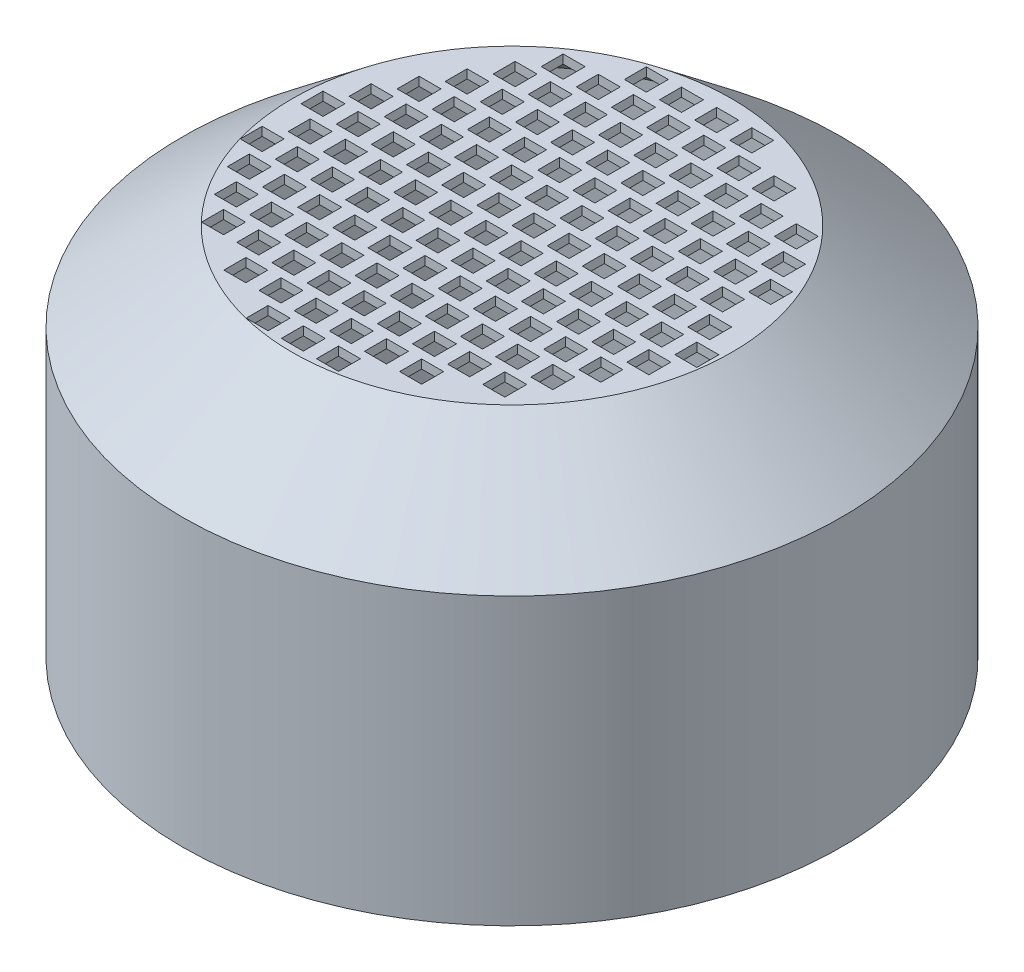
from build123d import *

# Parameters (mm, degrees)
SKETCH1_R               = 75
BOSS_EXTRUDE1_DEPTH     = 85
CHAMFER1_SIZE           = 20
CHAMFER1_SIZE2          = 25
SHELL1_T                = -2
SKETCH2_W               = 5
SKETCH2_H               = 5
CUT_EXTRUDE1_DEPTH      = 136.922772191
FILL_START              = 82.470761888
FILL_PATTERN1_OUTLINE_W = 5
FILL_PATTERN1_OUTLINE_H = 5
FILL_PATTERN1_DEPTH     = 2.529238112
EXTRUDE_THIN1_REACH     = 137.923
SKETCH3_R               = 66.5
SKETCH3_R_2             = 65


# Read off the part's stored shape, not the designer's step: Fill Pattern1
with BuildPart() as part:
    # Sketch1 → Boss-Extrude1 (new body)
    with BuildSketch(Plane(origin=(0, 0, 0), x_dir=(1, 0, 0), z_dir=(0, 1, 0))):
        with Locations(Location((0, 0, 0), (0, 0, 270))):
            Circle(SKETCH1_R)
    extrude(amount=BOSS_EXTRUDE1_DEPTH)

    # Chamfer1
    chamfer1_edges = [part.edges().sort_by_distance(p)[0] for p in [
        (0, 85, -75),
    ]]
    chamfer1_side = [part.faces().sort_by_distance(p)[0] for p in [
        (0, 42.5, -75),
    ]]
    chamfer(chamfer1_edges, length=CHAMFER1_SIZE, length2=CHAMFER1_SIZE2, reference=chamfer1_side[0])

    # Shell1
    shell1_openings = [part.faces().sort_by_distance(p)[0] for p in [
        (0, 0, 0),
    ]]
    offset(amount=SHELL1_T, openings=shell1_openings, kind=Kind.INTERSECTION)

    # Sketch2 → Cut-Extrude1 (cut, through all)
    with BuildSketch(Plane(origin=(0, 85, 0), x_dir=(1, 0, 0), z_dir=(0, 1, 0))):
        with Locations((2.5, 2.5)):
            Rectangle(SKETCH2_W, SKETCH2_H)
    extrude(amount=-CUT_EXTRUDE1_DEPTH, mode=Mode.SUBTRACT)

    # Fill Pattern1 outline → Fill Pattern1 (cut)
    with BuildSketch(Plane(origin=(0, 0, 0), x_dir=(1, 0, 0), z_dir=(0, 1, 0)).offset(FILL_START)):
        with Locations((2.5, 30.212812921)):
            Rectangle(FILL_PATTERN1_OUTLINE_W, FILL_PATTERN1_OUTLINE_H)
        with Locations((2.5, 44.069219382)):
            Rectangle(FILL_PATTERN1_OUTLINE_W, FILL_PATTERN1_OUTLINE_H)
        with Locations((2.5, 16.356406461)):
            Rectangle(FILL_PATTERN1_OUTLINE_W, FILL_PATTERN1_OUTLINE_H)
        with Locations((2.5, -39.069219382)):
            Rectangle(FILL_PATTERN1_OUTLINE_W, FILL_PATTERN1_OUTLINE_H)
        with Locations((2.5, -11.356406461)):
            Rectangle(FILL_PATTERN1_OUTLINE_W, FILL_PATTERN1_OUTLINE_H)
        with Locations((2.5, -25.212812921)):
            Rectangle(FILL_PATTERN1_OUTLINE_W, FILL_PATTERN1_OUTLINE_H)
        with Locations((-45.5, 2.5)):
            Rectangle(FILL_PATTERN1_OUTLINE_W, FILL_PATTERN1_OUTLINE_H)
        with Locations((-13.5, 2.5)):
            Rectangle(FILL_PATTERN1_OUTLINE_W, FILL_PATTERN1_OUTLINE_H)
        with Locations((-5.5, 2.5)):
            Rectangle(FILL_PATTERN1_OUTLINE_W, FILL_PATTERN1_OUTLINE_H)
        with Locations((-37.5, 2.5)):
            Rectangle(FILL_PATTERN1_OUTLINE_W, FILL_PATTERN1_OUTLINE_H)
        with Locations((-21.5, 2.5)):
            Rectangle(FILL_PATTERN1_OUTLINE_W, FILL_PATTERN1_OUTLINE_H)
        with Locations((-29.5, 2.5)):
            Rectangle(FILL_PATTERN1_OUTLINE_W, FILL_PATTERN1_OUTLINE_H)
        with Locations((26.5, 2.5)):
            Rectangle(FILL_PATTERN1_OUTLINE_W, FILL_PATTERN1_OUTLINE_H)
        with Locations((42.5, 2.5)):
            Rectangle(FILL_PATTERN1_OUTLINE_W, FILL_PATTERN1_OUTLINE_H)
        with Locations((34.5, 2.5)):
            Rectangle(FILL_PATTERN1_OUTLINE_W, FILL_PATTERN1_OUTLINE_H)
        with Locations((10.5, 2.5)):
            Rectangle(FILL_PATTERN1_OUTLINE_W, FILL_PATTERN1_OUTLINE_H)
        with Locations((18.5, 2.5)):
            Rectangle(FILL_PATTERN1_OUTLINE_W, FILL_PATTERN1_OUTLINE_H)
        with Locations((-45.5, -11.356406461)):
            Rectangle(FILL_PATTERN1_OUTLINE_W, FILL_PATTERN1_OUTLINE_H)
        with Locations((-33.5, -32.141016151)):
            Rectangle(FILL_PATTERN1_OUTLINE_W, FILL_PATTERN1_OUTLINE_H)
        with Locations((-17.5, -32.141016151)):
            Rectangle(FILL_PATTERN1_OUTLINE_W, FILL_PATTERN1_OUTLINE_H)
        with Locations((-25.5, -32.141016151)):
            Rectangle(FILL_PATTERN1_OUTLINE_W, FILL_PATTERN1_OUTLINE_H)
        with Locations((14.5, -32.141016151)):
            Rectangle(FILL_PATTERN1_OUTLINE_W, FILL_PATTERN1_OUTLINE_H)
        with Locations((6.5, -32.141016151)):
            Rectangle(FILL_PATTERN1_OUTLINE_W, FILL_PATTERN1_OUTLINE_H)
        with Locations((30.5, -32.141016151)):
            Rectangle(FILL_PATTERN1_OUTLINE_W, FILL_PATTERN1_OUTLINE_H)
        with Locations((22.5, -32.141016151)):
            Rectangle(FILL_PATTERN1_OUTLINE_W, FILL_PATTERN1_OUTLINE_H)
        with Locations((-9.5, -32.141016151)):
            Rectangle(FILL_PATTERN1_OUTLINE_W, FILL_PATTERN1_OUTLINE_H)
        with Locations((-1.5, -32.141016151)):
            Rectangle(FILL_PATTERN1_OUTLINE_W, FILL_PATTERN1_OUTLINE_H)
        with Locations((-33.5, 9.42820323)):
            Rectangle(FILL_PATTERN1_OUTLINE_W, FILL_PATTERN1_OUTLINE_H)
        with Locations((-33.5, 23.284609691)):
            Rectangle(FILL_PATTERN1_OUTLINE_W, FILL_PATTERN1_OUTLINE_H)
        with Locations((-33.5, -18.284609691)):
            Rectangle(FILL_PATTERN1_OUTLINE_W, FILL_PATTERN1_OUTLINE_H)
        with Locations((-33.5, -4.42820323)):
            Rectangle(FILL_PATTERN1_OUTLINE_W, FILL_PATTERN1_OUTLINE_H)
        with Locations((-21.5, -11.356406461)):
            Rectangle(FILL_PATTERN1_OUTLINE_W, FILL_PATTERN1_OUTLINE_H)
        with Locations((-13.5, -11.356406461)):
            Rectangle(FILL_PATTERN1_OUTLINE_W, FILL_PATTERN1_OUTLINE_H)
        with Locations((-29.5, -11.356406461)):
            Rectangle(FILL_PATTERN1_OUTLINE_W, FILL_PATTERN1_OUTLINE_H)
        with Locations((-37.5, -11.356406461)):
            Rectangle(FILL_PATTERN1_OUTLINE_W, FILL_PATTERN1_OUTLINE_H)
        with Locations((26.5, -11.356406461)):
            Rectangle(FILL_PATTERN1_OUTLINE_W, FILL_PATTERN1_OUTLINE_H)
        with Locations((18.5, -11.356406461)):
            Rectangle(FILL_PATTERN1_OUTLINE_W, FILL_PATTERN1_OUTLINE_H)
        with Locations((34.5, -11.356406461)):
            Rectangle(FILL_PATTERN1_OUTLINE_W, FILL_PATTERN1_OUTLINE_H)
        with Locations((42.5, -11.356406461)):
            Rectangle(FILL_PATTERN1_OUTLINE_W, FILL_PATTERN1_OUTLINE_H)
        with Locations((-5.5, -11.356406461)):
            Rectangle(FILL_PATTERN1_OUTLINE_W, FILL_PATTERN1_OUTLINE_H)
        with Locations((10.5, -11.356406461)):
            Rectangle(FILL_PATTERN1_OUTLINE_W, FILL_PATTERN1_OUTLINE_H)
        with Locations((6.5, -45.997422612)):
            Rectangle(FILL_PATTERN1_OUTLINE_W, FILL_PATTERN1_OUTLINE_H)
        with Locations((6.5, 37.141016151)):
            Rectangle(FILL_PATTERN1_OUTLINE_W, FILL_PATTERN1_OUTLINE_H)
        with Locations((6.5, 23.284609691)):
            Rectangle(FILL_PATTERN1_OUTLINE_W, FILL_PATTERN1_OUTLINE_H)
        with Locations((6.5, -4.42820323)):
            Rectangle(FILL_PATTERN1_OUTLINE_W, FILL_PATTERN1_OUTLINE_H)
        with Locations((6.5, 9.42820323)):
            Rectangle(FILL_PATTERN1_OUTLINE_W, FILL_PATTERN1_OUTLINE_H)
        with Locations((6.5, -18.284609691)):
            Rectangle(FILL_PATTERN1_OUTLINE_W, FILL_PATTERN1_OUTLINE_H)
        with Locations((-9.5, -45.997422612)):
            Rectangle(FILL_PATTERN1_OUTLINE_W, FILL_PATTERN1_OUTLINE_H)
        with Locations((-1.5, -45.997422612)):
            Rectangle(FILL_PATTERN1_OUTLINE_W, FILL_PATTERN1_OUTLINE_H)
        with Locations((46.5, -4.42820323)):
            Rectangle(FILL_PATTERN1_OUTLINE_W, FILL_PATTERN1_OUTLINE_H)
        with Locations((-17.5, -4.42820323)):
            Rectangle(FILL_PATTERN1_OUTLINE_W, FILL_PATTERN1_OUTLINE_H)
        with Locations((-9.5, -4.42820323)):
            Rectangle(FILL_PATTERN1_OUTLINE_W, FILL_PATTERN1_OUTLINE_H)
        with Locations((-41.5, -4.42820323)):
            Rectangle(FILL_PATTERN1_OUTLINE_W, FILL_PATTERN1_OUTLINE_H)
        with Locations((-25.5, -4.42820323)):
            Rectangle(FILL_PATTERN1_OUTLINE_W, FILL_PATTERN1_OUTLINE_H)
        with Locations((22.5, -4.42820323)):
            Rectangle(FILL_PATTERN1_OUTLINE_W, FILL_PATTERN1_OUTLINE_H)
        with Locations((38.5, -4.42820323)):
            Rectangle(FILL_PATTERN1_OUTLINE_W, FILL_PATTERN1_OUTLINE_H)
        with Locations((30.5, -4.42820323)):
            Rectangle(FILL_PATTERN1_OUTLINE_W, FILL_PATTERN1_OUTLINE_H)
        with Locations((-1.5, -4.42820323)):
            Rectangle(FILL_PATTERN1_OUTLINE_W, FILL_PATTERN1_OUTLINE_H)
        with Locations((14.5, -4.42820323)):
            Rectangle(FILL_PATTERN1_OUTLINE_W, FILL_PATTERN1_OUTLINE_H)
        with Locations((34.5, 30.212812921)):
            Rectangle(FILL_PATTERN1_OUTLINE_W, FILL_PATTERN1_OUTLINE_H)
        with Locations((34.5, 16.356406461)):
            Rectangle(FILL_PATTERN1_OUTLINE_W, FILL_PATTERN1_OUTLINE_H)
        with Locations((34.5, -25.212812921)):
            Rectangle(FILL_PATTERN1_OUTLINE_W, FILL_PATTERN1_OUTLINE_H)
        with Locations((-5.5, 30.212812921)):
            Rectangle(FILL_PATTERN1_OUTLINE_W, FILL_PATTERN1_OUTLINE_H)
        with Locations((10.5, 30.212812921)):
            Rectangle(FILL_PATTERN1_OUTLINE_W, FILL_PATTERN1_OUTLINE_H)
        with Locations((-21.5, 30.212812921)):
            Rectangle(FILL_PATTERN1_OUTLINE_W, FILL_PATTERN1_OUTLINE_H)
        with Locations((-29.5, 30.212812921)):
            Rectangle(FILL_PATTERN1_OUTLINE_W, FILL_PATTERN1_OUTLINE_H)
        with Locations((-13.5, 30.212812921)):
            Rectangle(FILL_PATTERN1_OUTLINE_W, FILL_PATTERN1_OUTLINE_H)
        with Locations((18.5, 30.212812921)):
            Rectangle(FILL_PATTERN1_OUTLINE_W, FILL_PATTERN1_OUTLINE_H)
        with Locations((26.5, 30.212812921)):
            Rectangle(FILL_PATTERN1_OUTLINE_W, FILL_PATTERN1_OUTLINE_H)
        with Locations((-9.5, 9.42820323)):
            Rectangle(FILL_PATTERN1_OUTLINE_W, FILL_PATTERN1_OUTLINE_H)
        with Locations((-9.5, 23.284609691)):
            Rectangle(FILL_PATTERN1_OUTLINE_W, FILL_PATTERN1_OUTLINE_H)
        with Locations((-9.5, -18.284609691)):
            Rectangle(FILL_PATTERN1_OUTLINE_W, FILL_PATTERN1_OUTLINE_H)
        with Locations((-9.5, 37.141016151)):
            Rectangle(FILL_PATTERN1_OUTLINE_W, FILL_PATTERN1_OUTLINE_H)
        with Locations((-1.5, 37.141016151)):
            Rectangle(FILL_PATTERN1_OUTLINE_W, FILL_PATTERN1_OUTLINE_H)
        with Locations((14.5, 37.141016151)):
            Rectangle(FILL_PATTERN1_OUTLINE_W, FILL_PATTERN1_OUTLINE_H)
        with Locations((-17.5, 37.141016151)):
            Rectangle(FILL_PATTERN1_OUTLINE_W, FILL_PATTERN1_OUTLINE_H)
        with Locations((-25.5, 37.141016151)):
            Rectangle(FILL_PATTERN1_OUTLINE_W, FILL_PATTERN1_OUTLINE_H)
        with Locations((22.5, 37.141016151)):
            Rectangle(FILL_PATTERN1_OUTLINE_W, FILL_PATTERN1_OUTLINE_H)
        with Locations((-1.5, 23.284609691)):
            Rectangle(FILL_PATTERN1_OUTLINE_W, FILL_PATTERN1_OUTLINE_H)
        with Locations((-1.5, 9.42820323)):
            Rectangle(FILL_PATTERN1_OUTLINE_W, FILL_PATTERN1_OUTLINE_H)
        with Locations((-1.5, -18.284609691)):
            Rectangle(FILL_PATTERN1_OUTLINE_W, FILL_PATTERN1_OUTLINE_H)
        with Locations((-25.5, 23.284609691)):
            Rectangle(FILL_PATTERN1_OUTLINE_W, FILL_PATTERN1_OUTLINE_H)
        with Locations((-17.5, 23.284609691)):
            Rectangle(FILL_PATTERN1_OUTLINE_W, FILL_PATTERN1_OUTLINE_H)
        with Locations((38.5, 23.284609691)):
            Rectangle(FILL_PATTERN1_OUTLINE_W, FILL_PATTERN1_OUTLINE_H)
        with Locations((14.5, 23.284609691)):
            Rectangle(FILL_PATTERN1_OUTLINE_W, FILL_PATTERN1_OUTLINE_H)
        with Locations((30.5, 23.284609691)):
            Rectangle(FILL_PATTERN1_OUTLINE_W, FILL_PATTERN1_OUTLINE_H)
        with Locations((22.5, 23.284609691)):
            Rectangle(FILL_PATTERN1_OUTLINE_W, FILL_PATTERN1_OUTLINE_H)
        with Locations((-5.5, 16.356406461)):
            Rectangle(FILL_PATTERN1_OUTLINE_W, FILL_PATTERN1_OUTLINE_H)
        with Locations((-5.5, 44.069219382)):
            Rectangle(FILL_PATTERN1_OUTLINE_W, FILL_PATTERN1_OUTLINE_H)
        with Locations((-5.5, -25.212812921)):
            Rectangle(FILL_PATTERN1_OUTLINE_W, FILL_PATTERN1_OUTLINE_H)
        with Locations((-5.5, -39.069219382)):
            Rectangle(FILL_PATTERN1_OUTLINE_W, FILL_PATTERN1_OUTLINE_H)
        with Locations((-29.5, 16.356406461)):
            Rectangle(FILL_PATTERN1_OUTLINE_W, FILL_PATTERN1_OUTLINE_H)
        with Locations((-37.5, 16.356406461)):
            Rectangle(FILL_PATTERN1_OUTLINE_W, FILL_PATTERN1_OUTLINE_H)
        with Locations((-13.5, 16.356406461)):
            Rectangle(FILL_PATTERN1_OUTLINE_W, FILL_PATTERN1_OUTLINE_H)
        with Locations((-21.5, 16.356406461)):
            Rectangle(FILL_PATTERN1_OUTLINE_W, FILL_PATTERN1_OUTLINE_H)
        with Locations((42.5, 16.356406461)):
            Rectangle(FILL_PATTERN1_OUTLINE_W, FILL_PATTERN1_OUTLINE_H)
        with Locations((10.5, 16.356406461)):
            Rectangle(FILL_PATTERN1_OUTLINE_W, FILL_PATTERN1_OUTLINE_H)
        with Locations((26.5, 16.356406461)):
            Rectangle(FILL_PATTERN1_OUTLINE_W, FILL_PATTERN1_OUTLINE_H)
        with Locations((18.5, 16.356406461)):
            Rectangle(FILL_PATTERN1_OUTLINE_W, FILL_PATTERN1_OUTLINE_H)
        with Locations((-41.5, 9.42820323)):
            Rectangle(FILL_PATTERN1_OUTLINE_W, FILL_PATTERN1_OUTLINE_H)
        with Locations((-17.5, 9.42820323)):
            Rectangle(FILL_PATTERN1_OUTLINE_W, FILL_PATTERN1_OUTLINE_H)
        with Locations((-25.5, 9.42820323)):
            Rectangle(FILL_PATTERN1_OUTLINE_W, FILL_PATTERN1_OUTLINE_H)
        with Locations((30.5, 9.42820323)):
            Rectangle(FILL_PATTERN1_OUTLINE_W, FILL_PATTERN1_OUTLINE_H)
        with Locations((38.5, 9.42820323)):
            Rectangle(FILL_PATTERN1_OUTLINE_W, FILL_PATTERN1_OUTLINE_H)
        with Locations((14.5, 9.42820323)):
            Rectangle(FILL_PATTERN1_OUTLINE_W, FILL_PATTERN1_OUTLINE_H)
        with Locations((22.5, 9.42820323)):
            Rectangle(FILL_PATTERN1_OUTLINE_W, FILL_PATTERN1_OUTLINE_H)
        with Locations((-13.5, -25.212812921)):
            Rectangle(FILL_PATTERN1_OUTLINE_W, FILL_PATTERN1_OUTLINE_H)
        with Locations((-13.5, 44.069219382)):
            Rectangle(FILL_PATTERN1_OUTLINE_W, FILL_PATTERN1_OUTLINE_H)
        with Locations((-13.5, -39.069219382)):
            Rectangle(FILL_PATTERN1_OUTLINE_W, FILL_PATTERN1_OUTLINE_H)
        with Locations((-17.5, -18.284609691)):
            Rectangle(FILL_PATTERN1_OUTLINE_W, FILL_PATTERN1_OUTLINE_H)
        with Locations((-21.5, -39.069219382)):
            Rectangle(FILL_PATTERN1_OUTLINE_W, FILL_PATTERN1_OUTLINE_H)
        with Locations((-21.5, -25.212812921)):
            Rectangle(FILL_PATTERN1_OUTLINE_W, FILL_PATTERN1_OUTLINE_H)
        with Locations((-25.5, -18.284609691)):
            Rectangle(FILL_PATTERN1_OUTLINE_W, FILL_PATTERN1_OUTLINE_H)
        with Locations((-41.5, -18.284609691)):
            Rectangle(FILL_PATTERN1_OUTLINE_W, FILL_PATTERN1_OUTLINE_H)
        with Locations((22.5, -18.284609691)):
            Rectangle(FILL_PATTERN1_OUTLINE_W, FILL_PATTERN1_OUTLINE_H)
        with Locations((14.5, -18.284609691)):
            Rectangle(FILL_PATTERN1_OUTLINE_W, FILL_PATTERN1_OUTLINE_H)
        with Locations((38.5, -18.284609691)):
            Rectangle(FILL_PATTERN1_OUTLINE_W, FILL_PATTERN1_OUTLINE_H)
        with Locations((30.5, -18.284609691)):
            Rectangle(FILL_PATTERN1_OUTLINE_W, FILL_PATTERN1_OUTLINE_H)
        with Locations((-29.5, -25.212812921)):
            Rectangle(FILL_PATTERN1_OUTLINE_W, FILL_PATTERN1_OUTLINE_H)
        with Locations((-37.5, -25.212812921)):
            Rectangle(FILL_PATTERN1_OUTLINE_W, FILL_PATTERN1_OUTLINE_H)
        with Locations((18.5, -25.212812921)):
            Rectangle(FILL_PATTERN1_OUTLINE_W, FILL_PATTERN1_OUTLINE_H)
        with Locations((10.5, -25.212812921)):
            Rectangle(FILL_PATTERN1_OUTLINE_W, FILL_PATTERN1_OUTLINE_H)
        with Locations((26.5, -25.212812921)):
            Rectangle(FILL_PATTERN1_OUTLINE_W, FILL_PATTERN1_OUTLINE_H)
        with Locations((10.5, 44.069219382)):
            Rectangle(FILL_PATTERN1_OUTLINE_W, FILL_PATTERN1_OUTLINE_H)
        with Locations((10.5, -39.069219382)):
            Rectangle(FILL_PATTERN1_OUTLINE_W, FILL_PATTERN1_OUTLINE_H)
        with Locations((18.5, -39.069219382)):
            Rectangle(FILL_PATTERN1_OUTLINE_W, FILL_PATTERN1_OUTLINE_H)
    extrude(amount=FILL_PATTERN1_DEPTH, mode=Mode.SUBTRACT)

    # Extrude-Thin1: up to this cone (the profile starts inside it)
    extrude_thin1_end = Plane(origin=(0, 0, 0), z_dir=(0, -1, 0)).offset(-122.438749305) * Cone(1.25e-06, 517.387735233, 413.910187186, align=(Align.CENTER, Align.CENTER, Align.MIN), mode=Mode.PRIVATE)
    # Sketch3 → Extrude-Thin1 (add, up to the surface)
    with BuildSketch(Plane.XZ, mode=Mode.PRIVATE) as extrude_thin1_sk1:
        Circle(SKETCH3_R)
        Circle(SKETCH3_R_2, mode=Mode.SUBTRACT)
    extrude_thin1_tool1 = extrude(extrude_thin1_sk1.sketch, amount=-EXTRUDE_THIN1_REACH, mode=Mode.PRIVATE) & extrude_thin1_end
    add(extrude_thin1_tool1.solids().sort_by_distance((-66.31191, 0, 0))[0])


solid = part.part
